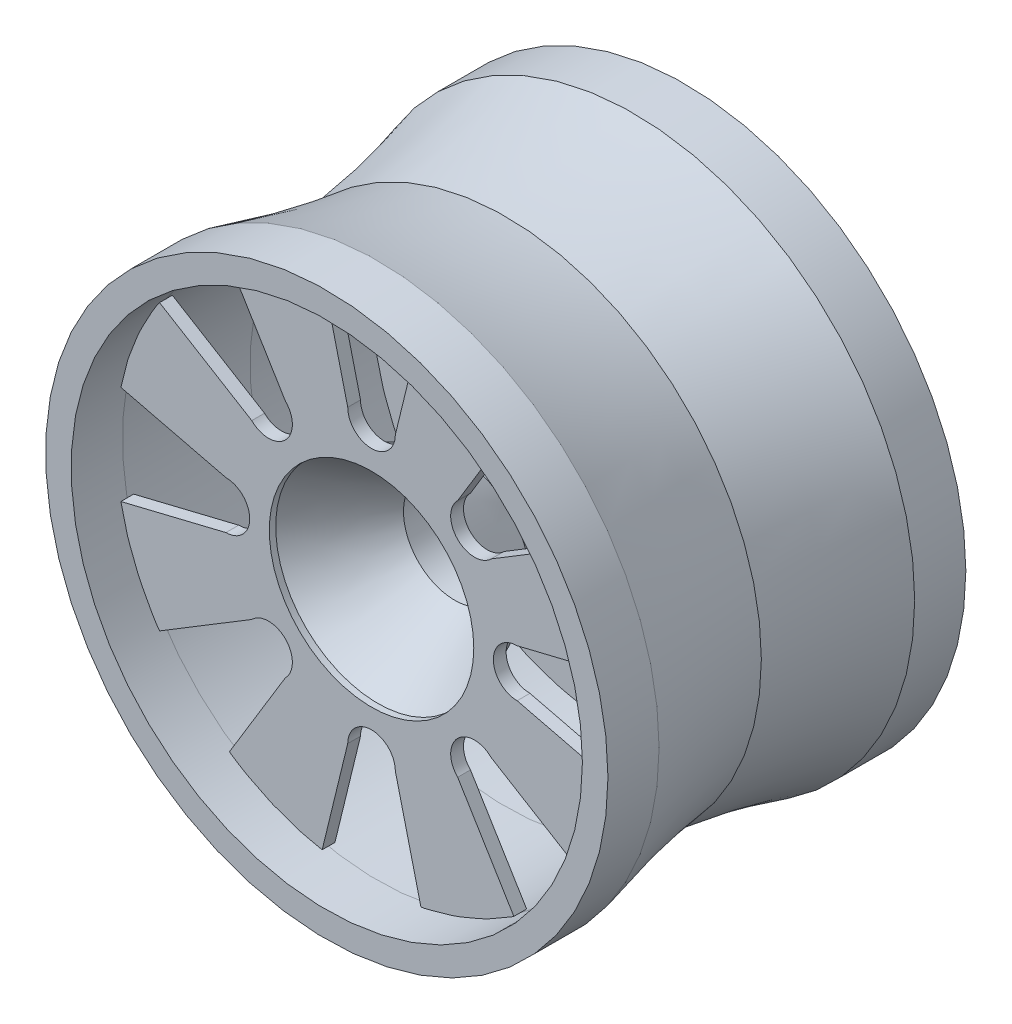
from build123d import *

# Parameters (mm, degrees)
SKETCH_1_R      = 20
EXTRUDE_1_DEPTH = 1.25
SKETCH_4_R      = 20
EXTRUDE_2_DEPTH = 1.25
SKETCH_1_7_R    = 55
SKETCH_1_7_R_2  = 50
EXTRUDE_3_DEPTH = 10
SKETCH_4_4_R    = 55
SKETCH_4_4_R_2  = 50
EXTRUDE_4_DEPTH = 10
EXTRUDE_5_REACH = 91.861
SKETCH_9_R      = 15
SKETCH_9_R_2    = 10


# Read off the part's stored shape, not the designer's step: 旋轉5
with BuildPart() as part:
    # 草圖1 → 填料-伸長1 (new, symmetric)
    with BuildSketch(Plane.XY):
        with BuildLine():
            ThreePointArc((4.655456144, 28.48054769), (0, 23.825091546), (-4.655456144, 28.48054769))
            Line((-4.655456144, 28.48054769), (-9.673077437, 49.055392903))
            ThreePointArc((-9.673077437, 49.055392903), (-19.134171618, 46.193976626), (-27.847502325, 41.527299626))
            Line((-27.847502325, 41.527299626), (-16.846883794, 23.430693012))
            ThreePointArc((-16.846883794, 23.430693012), (-16.846883794, 16.846883794), (-23.430693012, 16.846883794))
            Line((-23.430693012, 16.846883794), (-41.527299626, 27.847502325))
            ThreePointArc((-41.527299626, 27.847502325), (-46.193976626, 19.134171618), (-49.055392903, 9.673077437))
            Line((-49.055392903, 9.673077437), (-28.48054769, 4.655456144))
            ThreePointArc((-28.48054769, 4.655456144), (-23.825091546, 0), (-28.48054769, -4.655456144))
            Line((-28.48054769, -4.655456144), (-49.055392903, -9.673077437))
            ThreePointArc((-49.055392903, -9.673077437), (-46.193976626, -19.134171618), (-41.527299626, -27.847502325))
            Line((-41.527299626, -27.847502325), (-23.430693012, -16.846883794))
            ThreePointArc((-23.430693012, -16.846883794), (-16.846883794, -16.846883794), (-16.846883794, -23.430693012))
            Line((-16.846883794, -23.430693012), (-27.847502325, -41.527299626))
            ThreePointArc((-27.847502325, -41.527299626), (-19.134171618, -46.193976626), (-9.673077437, -49.055392903))
            Line((-9.673077437, -49.055392903), (-4.655456144, -28.48054769))
            ThreePointArc((-4.655456144, -28.48054769), (0, -23.825091546), (4.655456144, -28.48054769))
            Line((4.655456144, -28.48054769), (9.673077437, -49.055392903))
            ThreePointArc((9.673077437, -49.055392903), (19.134171618, -46.193976626), (27.847502325, -41.527299626))
            Line((27.847502325, -41.527299626), (16.846883794, -23.430693012))
            ThreePointArc((16.846883794, -23.430693012), (16.846883794, -16.846883794), (23.430693012, -16.846883794))
            Line((23.430693012, -16.846883794), (41.527299626, -27.847502325))
            ThreePointArc((41.527299626, -27.847502325), (46.193976626, -19.134171618), (49.055392903, -9.673077437))
            Line((49.055392903, -9.673077437), (28.48054769, -4.655456144))
            ThreePointArc((28.48054769, -4.655456144), (23.825091546, 0), (28.48054769, 4.655456144))
            Line((28.48054769, 4.655456144), (49.055392903, 9.673077437))
            ThreePointArc((49.055392903, 9.673077437), (46.193976626, 19.134171618), (41.527299626, 27.847502325))
            Line((41.527299626, 27.847502325), (23.430693012, 16.846883794))
            ThreePointArc((23.430693012, 16.846883794), (16.846883794, 16.846883794), (16.846883794, 23.430693012))
            Line((16.846883794, 23.430693012), (27.847502325, 41.527299626))
            ThreePointArc((27.847502325, 41.527299626), (19.134171618, 46.193976626), (9.673077437, 49.055392903))
            Line((9.673077437, 49.055392903), (4.655456144, 28.48054769))
        make_face()
        Circle(SKETCH_1_R, mode=Mode.SUBTRACT)
    extrude(amount=EXTRUDE_1_DEPTH, both=True)


with BuildPart() as body_2:
    # 草圖4 → 填料-伸長2 (new, symmetric)
    with BuildSketch(Plane.XY.offset(-50)):
        with BuildLine():
            ThreePointArc((4.655456144, 28.48054769), (0, 23.825091546), (-4.655456144, 28.48054769))
            Line((-4.655456144, 28.48054769), (-9.673077437, 49.055392903))
            ThreePointArc((-9.673077437, 49.055392903), (-19.134171618, 46.193976626), (-27.847502325, 41.527299626))
            Line((-27.847502325, 41.527299626), (-16.846883794, 23.430693012))
            ThreePointArc((-16.846883794, 23.430693012), (-16.846883794, 16.846883794), (-23.430693012, 16.846883794))
            Line((-23.430693012, 16.846883794), (-41.527299626, 27.847502325))
            ThreePointArc((-41.527299626, 27.847502325), (-46.193976626, 19.134171618), (-49.055392903, 9.673077437))
            Line((-49.055392903, 9.673077437), (-28.48054769, 4.655456144))
            ThreePointArc((-28.48054769, 4.655456144), (-23.825091546, 0), (-28.48054769, -4.655456144))
            Line((-28.48054769, -4.655456144), (-49.055392903, -9.673077437))
            ThreePointArc((-49.055392903, -9.673077437), (-46.193976626, -19.134171618), (-41.527299626, -27.847502325))
            Line((-41.527299626, -27.847502325), (-23.430693012, -16.846883794))
            ThreePointArc((-23.430693012, -16.846883794), (-16.846883794, -16.846883794), (-16.846883794, -23.430693012))
            Line((-16.846883794, -23.430693012), (-27.847502325, -41.527299626))
            ThreePointArc((-27.847502325, -41.527299626), (-19.134171618, -46.193976626), (-9.673077437, -49.055392903))
            Line((-9.673077437, -49.055392903), (-4.655456144, -28.48054769))
            ThreePointArc((-4.655456144, -28.48054769), (0, -23.825091546), (4.655456144, -28.48054769))
            Line((4.655456144, -28.48054769), (9.673077437, -49.055392903))
            ThreePointArc((9.673077437, -49.055392903), (19.134171618, -46.193976626), (27.847502325, -41.527299626))
            Line((27.847502325, -41.527299626), (16.846883794, -23.430693012))
            ThreePointArc((16.846883794, -23.430693012), (16.846883794, -16.846883794), (23.430693012, -16.846883794))
            Line((23.430693012, -16.846883794), (41.527299626, -27.847502325))
            ThreePointArc((41.527299626, -27.847502325), (46.193976626, -19.134171618), (49.055392903, -9.673077437))
            Line((49.055392903, -9.673077437), (28.48054769, -4.655456144))
            ThreePointArc((28.48054769, -4.655456144), (23.825091546, 0), (28.48054769, 4.655456144))
            Line((28.48054769, 4.655456144), (49.055392903, 9.673077437))
            ThreePointArc((49.055392903, 9.673077437), (46.193976626, 19.134171618), (41.527299626, 27.847502325))
            Line((41.527299626, 27.847502325), (23.430693012, 16.846883794))
            ThreePointArc((23.430693012, 16.846883794), (16.846883794, 16.846883794), (16.846883794, 23.430693012))
            Line((16.846883794, 23.430693012), (27.847502325, 41.527299626))
            ThreePointArc((27.847502325, 41.527299626), (19.134171618, 46.193976626), (9.673077437, 49.055392903))
            Line((9.673077437, 49.055392903), (4.655456144, 28.48054769))
        make_face()
        Circle(SKETCH_4_R, mode=Mode.SUBTRACT)
    extrude(amount=EXTRUDE_2_DEPTH, both=True)


with BuildPart() as body_3:
    # 草圖7 → 旋轉3 (revolve)
    with BuildSketch(Plane(origin=(0, 0, 0), x_dir=(0, 0, -1), z_dir=(1, 0, 0)), mode=Mode.PRIVATE) as revolve_3_sk:
        with BuildLine():
            Line((0, 55), (0, 50))
            Line((0, 50), (25, 50))
            ThreePointArc((25, 50), (12.396472947, 51.982364734), (0, 55))
        make_face()
        with BuildLine():
            ThreePointArc((50, 55), (37.603527053, 51.982364734), (25, 50))
            Line((25, 50), (50, 50))
            Line((50, 50), (50, 55))
        make_face()
    revolve(revolve_3_sk.sketch.rotate(Axis((0, 0, 90.082962862), (0, 0, -1)), 90), axis=Axis((0, 0, 90.082962862), (0, 0, -1)))


with BuildPart() as body_4:
    # 草圖1<7> → 填料-伸長3 (new body)
    with BuildSketch(Plane.XY):
        Circle(SKETCH_1_7_R)
        Circle(SKETCH_1_7_R_2, mode=Mode.SUBTRACT)
    extrude(amount=EXTRUDE_3_DEPTH)


with BuildPart() as body_5:
    # 草圖4<4> → 填料-伸長4 (new body)
    with BuildSketch(Plane.XY.offset(-50)):
        Circle(SKETCH_4_4_R)
        Circle(SKETCH_4_4_R_2, mode=Mode.SUBTRACT)
    extrude(amount=-EXTRUDE_4_DEPTH)


with BuildPart() as body_6:
    # 旋轉5 outline → 旋轉5 (revolve)
    with BuildSketch(Plane.XZ):
        Polygon((10, -15), (15, -15), (21.961820044, 0), (20, 0), align=None)
        Polygon((20, -50), (21.961820044, -50), (15, -35), (10, -35), align=None)
    revolve(axis=Axis((0, 0, 0), (0, 0, 1)))

    # 草圖9 → 填料-伸長5 (add, up to next)
    with BuildSketch(Plane.XY.offset(-15), mode=Mode.PRIVATE) as extrude_5_sk1:
        Circle(SKETCH_9_R)
        Circle(SKETCH_9_R_2, mode=Mode.SUBTRACT)
    extrude_5_tool1 = extrude(extrude_5_sk1.sketch, amount=-EXTRUDE_5_REACH, mode=Mode.PRIVATE) - body_6.part
    add(extrude_5_tool1.solids().sort_by_distance((-14.575736, 0, -15))[0])


solid = Compound([part.part, body_2.part, body_3.part, body_4.part, body_5.part, body_6.part])
